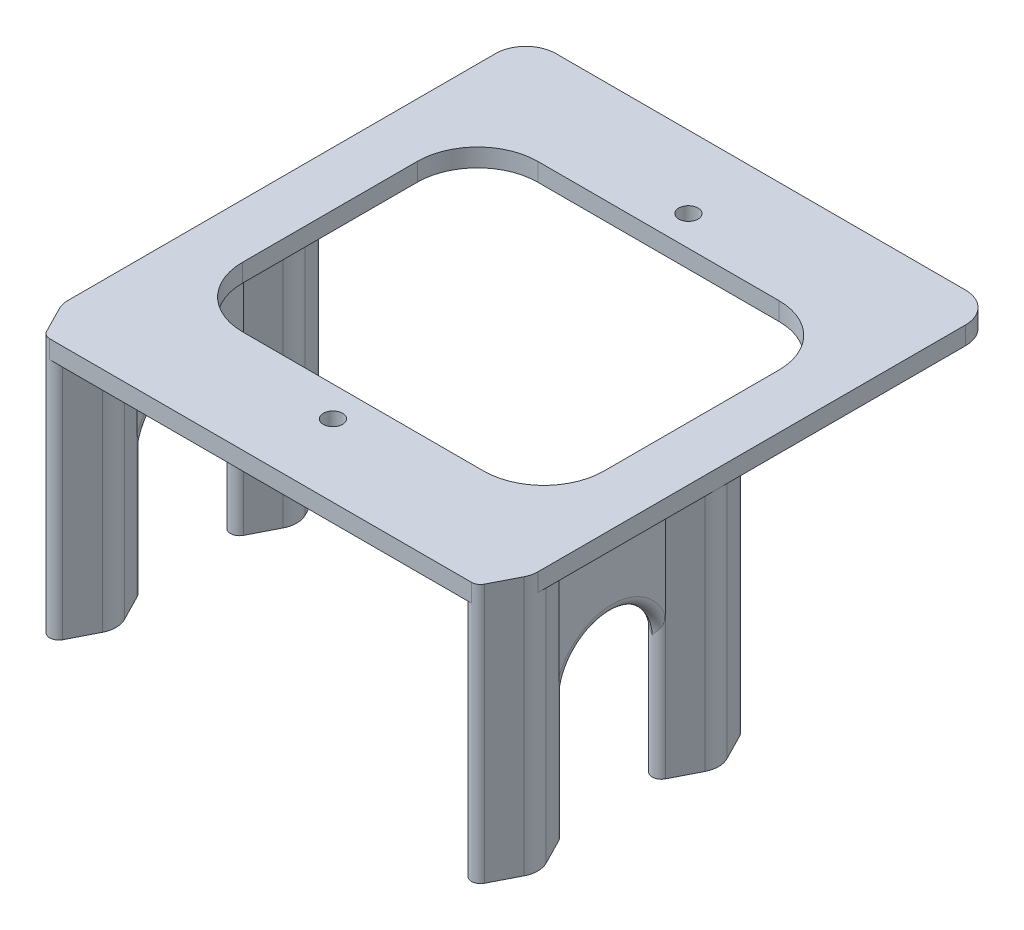
from build123d import *

# Parameters (mm, degrees)
SKETCH1_R             = 1.6
BOSS_EXTRUDE1_DEPTH   = 40
BOSS_EXTRUDE1_2_DEPTH = 40
BOSS_EXTRUDE1_3_DEPTH = 40
BOSS_EXTRUDE1_4_DEPTH = 40
SKETCH2_R             = 1.6
BOSS_EXTRUDE2_DEPTH   = 3
SKETCH4_W             = 2.672170628
SKETCH4_H             = 17.636363636
BOSS_EXTRUDE3_DEPTH   = 20
SKETCH6_R             = 8
CUT_EXTRUDE2_DEPTH    = 99.18617902
FILLET1_R             = 1.5
BOSS_EXTRUDE4_START   = 20
SKETCH7_R             = 1.6
BOSS_EXTRUDE4_DEPTH   = 20


# Read off the part's stored shape, not the designer's step: Mirror2
with BuildPart() as part:
    # Sketch1 → Boss-Extrude1 (new body)
    with BuildSketch(Plane(origin=(0, 0, 0), x_dir=(1, 0, 0), z_dir=(0, 1, 0))):
        with BuildLine():
            Line((-1.336085314, 6.181818182), (-3.562894171, 1.818181818))
            ThreePointArc((-3.562894171, 1.818181818), (-4, 0), (-3.562894171, -1.818181818))
            Line((-3.562894171, -1.818181818), (-1.336085314, -6.181818182))
            ThreePointArc((-1.336085314, -6.181818182), (0, -7), (1.336085314, -6.181818182))
            Line((1.336085314, -6.181818182), (3.562894171, -1.818181818))
            ThreePointArc((3.562894171, -1.818181818), (4, 0), (3.562894171, 1.818181818))
            Line((3.562894171, 1.818181818), (1.336085314, 6.181818182))
            ThreePointArc((1.336085314, 6.181818182), (0, 7), (-1.336085314, 6.181818182))
        make_face()
        with Locations(Location((0, 0, 0), (0, 0, 270))):
            Circle(SKETCH1_R, mode=Mode.SUBTRACT)
    extrude(amount=BOSS_EXTRUDE1_DEPTH)



with BuildPart() as body_2:
    # Sketch1 → Boss-Extrude1 2 (new body)
    with BuildSketch(Plane(origin=(0, 0, 0), x_dir=(1, 0, 0), z_dir=(0, 1, 0))):
        with BuildLine():
            Line((68.663914686, 6.181818182), (66.437105829, 1.818181818))
            ThreePointArc((66.437105829, 1.818181818), (66, 0), (66.437105829, -1.818181818))
            Line((66.437105829, -1.818181818), (68.663914686, -6.181818182))
            ThreePointArc((68.663914686, -6.181818182), (70, -7), (71.336085314, -6.181818182))
            Line((71.336085314, -6.181818182), (73.562894171, -1.818181818))
            ThreePointArc((73.562894171, -1.818181818), (74, 0), (73.562894171, 1.818181818))
            Line((73.562894171, 1.818181818), (71.336085314, 6.181818182))
            ThreePointArc((71.336085314, 6.181818182), (70, 7), (68.663914686, 6.181818182))
        make_face()
        with Locations(Location((70, 0, 0), (0, 0, 270))):
            Circle(SKETCH1_R, mode=Mode.SUBTRACT)
    extrude(amount=BOSS_EXTRUDE1_2_DEPTH)


with BuildPart() as body_3:
    # Sketch1 → Boss-Extrude1 3 (new body)
    with BuildSketch(Plane(origin=(0, 0, 0), x_dir=(1, 0, 0), z_dir=(0, 1, 0))):
        with BuildLine():
            Line((68.663914686, -23.818181818), (66.437105829, -28.181818182))
            ThreePointArc((66.437105829, -28.181818182), (66, -30), (66.437105829, -31.818181818))
            Line((66.437105829, -31.818181818), (68.663914686, -36.181818182))
            ThreePointArc((68.663914686, -36.181818182), (70, -37), (71.336085314, -36.181818182))
            Line((71.336085314, -36.181818182), (73.562894171, -31.818181818))
            ThreePointArc((73.562894171, -31.818181818), (74, -30), (73.562894171, -28.181818182))
            Line((73.562894171, -28.181818182), (71.336085314, -23.818181818))
            ThreePointArc((71.336085314, -23.818181818), (70, -23), (68.663914686, -23.818181818))
        make_face()
        with Locations(Location((70, -30, 0), (0, 0, 270))):
            Circle(SKETCH1_R, mode=Mode.SUBTRACT)
    extrude(amount=BOSS_EXTRUDE1_3_DEPTH)


with BuildPart() as body_4:
    # Sketch1 → Boss-Extrude1 4 (new body)
    with BuildSketch(Plane(origin=(0, 0, 0), x_dir=(1, 0, 0), z_dir=(0, 1, 0))):
        with BuildLine():
            Line((-1.336085314, -23.818181818), (-3.562894171, -28.181818182))
            ThreePointArc((-3.562894171, -28.181818182), (-4, -30), (-3.562894171, -31.818181818))
            Line((-3.562894171, -31.818181818), (-1.336085314, -36.181818182))
            ThreePointArc((-1.336085314, -36.181818182), (0, -37), (1.336085314, -36.181818182))
            Line((1.336085314, -36.181818182), (3.562894171, -31.818181818))
            ThreePointArc((3.562894171, -31.818181818), (4, -30), (3.562894171, -28.181818182))
            Line((3.562894171, -28.181818182), (1.336085314, -23.818181818))
            ThreePointArc((1.336085314, -23.818181818), (0, -23), (-1.336085314, -23.818181818))
        make_face()
        with Locations(Location((0, -30, 0), (0, 0, 270))):
            Circle(SKETCH1_R, mode=Mode.SUBTRACT)
    extrude(amount=BOSS_EXTRUDE1_4_DEPTH)


with BuildPart() as part_1:
    add(part.part)

    add(body_2.part)  # Boss-Extrude2 merges body 2

    add(body_3.part)  # Boss-Extrude2 merges body 3

    add(body_4.part)  # Boss-Extrude2 merges body 4
    # Sketch2 → Boss-Extrude2 (add)
    with BuildSketch(Plane(origin=(0, 40, 0), x_dir=(1, 0, 0), z_dir=(0, 1, 0))):
        with BuildLine():
            Line((1, 46), (69, 46))
            ThreePointArc((69, 46), (72.535533906, 44.535533906), (74, 41))
            Line((74, 41), (74, -30))
            ThreePointArc((74, -30), (73.889188648, -30.934992865), (73.562894171, -31.818181818))
            Line((73.562894171, -31.818181818), (71.336085314, -36.181818182))
            ThreePointArc((71.336085314, -36.181818182), (70.783349452, -36.779204298), (70, -37))
            Line((70, -37), (0, -37))
            ThreePointArc((0, -37), (-0.783349452, -36.779204298), (-1.336085314, -36.181818182))
            Line((-1.336085314, -36.181818182), (-3.562894171, -31.818181818))
            ThreePointArc((-3.562894171, -31.818181818), (-3.889188648, -30.934992865), (-4, -30))
            Line((-4, -30), (-4, 41))
            ThreePointArc((-4, 41), (-2.535533906, 44.535533906), (1, 46))
        make_face()
        with Locations(Location((35, -25, 0), (0, 0, 270))):
            Circle(SKETCH2_R, mode=Mode.SUBTRACT)
        with Locations(Location((35, 34, 0), (0, 0, 270))):
            Circle(SKETCH2_R, mode=Mode.SUBTRACT)
        with BuildLine():
            Line((15, 29), (55, 29))
            ThreePointArc((55, 29), (62.071067812, 26.071067812), (65, 19))
            Line((65, 19), (65, -10))
            ThreePointArc((65, -10), (62.071067812, -17.071067812), (55, -20))
            Line((55, -20), (15, -20))
            ThreePointArc((15, -20), (7.928932188, -17.071067812), (5, -10))
            Line((5, -10), (5, 19))
            ThreePointArc((5, 19), (7.928932188, 26.071067812), (15, 29))
        make_face(mode=Mode.SUBTRACT)
    extrude(amount=BOSS_EXTRUDE2_DEPTH)

    # Sketch4 → Boss-Extrude3 (add)
    with BuildSketch(Plane.XZ.offset(-40)):
        with Locations((0, 15)):
            Rectangle(SKETCH4_W, SKETCH4_H)
    extrude(amount=BOSS_EXTRUDE3_DEPTH)

    # Sketch6 → Cut-Extrude2 (cut, through all)
    with BuildSketch(Plane.ZY.offset(1.336085314)):
        with Locations((15, 20)):
            Circle(SKETCH6_R)
    extrude(amount=-CUT_EXTRUDE2_DEPTH, mode=Mode.SUBTRACT)

    # Fillet1
    # the kernel refuses this fillet: 1.5 mm, written as the material it takes off along each edge
    with BuildSketch(Plane(origin=(1.336085314, 20, 15), x_dir=(0, -0.45244386791178526, 0.8917928831231068), z_dir=(0, -0.8917928831231068, -0.45244386791178526))) as fillet1_piece_1_section:
        with BuildLine():
            CenterArc((8 + FILLET1_R, FILLET1_R), FILLET1_R, 180, 90)
            Line((8, FILLET1_R), (8, 0))
            Line((8, 0), (8 + FILLET1_R, 0))
        make_face()
    fillet1_piece_1 = revolve(axis=Axis((1.336085314, 20, 15), (-1, 0, 0)), revolution_arc=233.801176838, mode=Mode.PRIVATE)
    fillet1_piece_1 = fillet1_piece_1 - Plane(origin=(0, 21.66747918, 5.5), x_dir=(-0.8907235428302468, 0, 0.45454545454545436), z_dir=(0, -1, 0)) * Cylinder(1.5, 38, mode=Mode.PRIVATE)
    fillet1_piece_1 = fillet1_piece_1 - Plane(origin=(0, 21.66747918, 24.5), x_dir=(0.8907235428302462, 0, -0.4545454545454553), z_dir=(0, -1, 0)) * Cylinder(1.5, 38, mode=Mode.PRIVATE)
    add(fillet1_piece_1, mode=Mode.SUBTRACT)
    with BuildSketch(Plane(origin=(-1.336085314, 20, 15), x_dir=(0, -0.45244386791178526, 0.8917928831231068), z_dir=(0, -0.8917928831231068, -0.45244386791178526))) as fillet1_piece_2_section:
        with BuildLine():
            CenterArc((8 + FILLET1_R, -FILLET1_R), FILLET1_R, 90, 90)
            Line((8, -FILLET1_R), (8, 0))
            Line((8, 0), (8 + FILLET1_R, 0))
        make_face()
    fillet1_piece_2 = revolve(axis=Axis((-1.336085314, 20, 15), (-1, 0, 0)), revolution_arc=233.801176838, mode=Mode.PRIVATE)
    fillet1_piece_2 = fillet1_piece_2 - Plane(origin=(0, 21.66746874, 5.5), x_dir=(-0.8907235428302468, 0, 0.45454545454545436), z_dir=(0, -1, 0)) * Cylinder(1.5, 39, mode=Mode.PRIVATE)
    fillet1_piece_2 = fillet1_piece_2 - Plane(origin=(0, 21.66746874, 24.5), x_dir=(0.8907235428302462, 0, -0.4545454545454553), z_dir=(0, -1, 0)) * Cylinder(1.5, 39, mode=Mode.PRIVATE)
    add(fillet1_piece_2, mode=Mode.SUBTRACT)

    # Sketch7 → Boss-Extrude4 (add)
    with BuildSketch(Plane.XZ.offset(-40).offset(BOSS_EXTRUDE4_START)):
        with Locations(Location((0, 30, 0), (0, 0, 270))):
            Circle(SKETCH7_R)
        with Locations(Location((0, 0, 0), (0, 0, 270))):
            Circle(SKETCH7_R)
        with Locations(Location((70, 0, 0), (0, 0, 270))):
            Circle(SKETCH7_R)
        with Locations(Location((70, 30, 0), (0, 0, 270))):
            Circle(SKETCH7_R)
    extrude(amount=-BOSS_EXTRUDE4_DEPTH)

    # Mirror2: part across plane


with BuildPart() as part_2:
    add(part_1.part)
    add(part_1.part.mirror(Plane.ZY.offset(-35)))


solid = part_2.part
